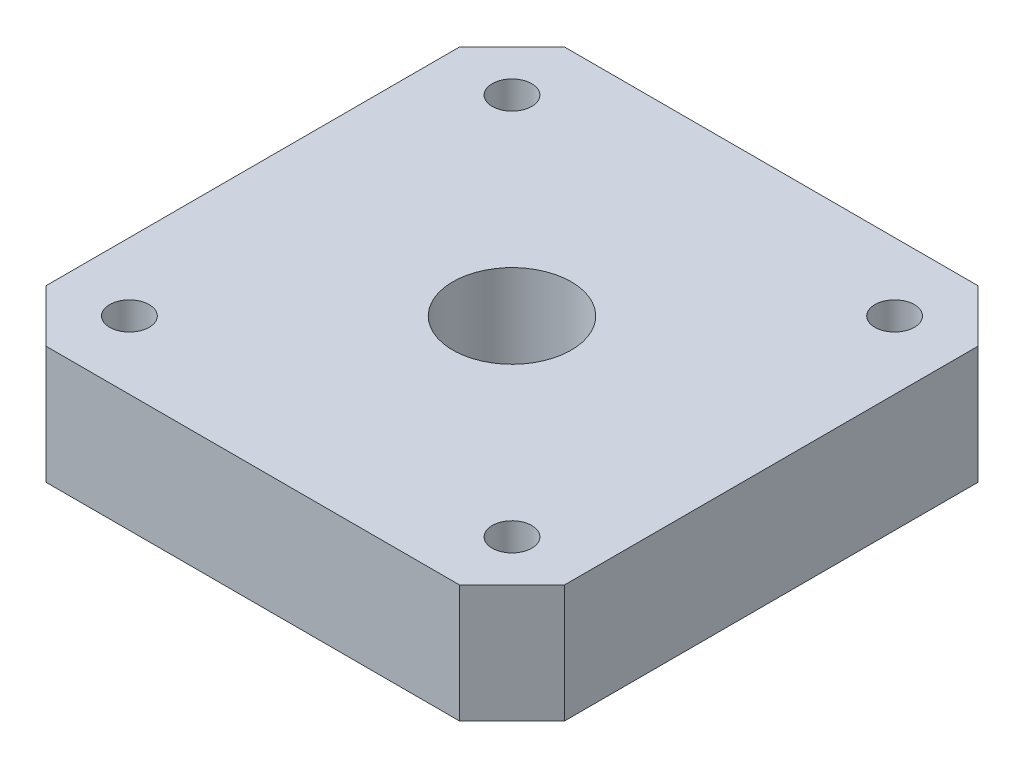
from build123d import *

# Parameters (mm, degrees)
ESBO_O1_W             = 42
ESBO_O1_H             = 42
FLANGE_BASE1_DEPTH    = 9.55
CORTE_EXTRUS_O2_DEPTH = 32.196193678
ESBO_O4_R             = 4.8
CORTE_EXTRUS_O4_DEPTH = 32.196193678
ESBO_O16_R            = 2
CORTE_EXTRUS_O6_DEPTH = 3
ESBO_O19_R            = 1.6
CORTE_EXTRUS_O7_DEPTH = 31.412209719


# Sheet-metal steps are written as plain solids
with BuildPart() as part:
    # Esboço1 → Flange-base1 (new body)
    with BuildSketch(Plane(origin=(0, 0, 0), x_dir=(1, 0, 0), z_dir=(0, 1, 0))):
        Rectangle(ESBO_O1_W, ESBO_O1_H)
    extrude(amount=-FLANGE_BASE1_DEPTH)

    # Esboço3 → Corte-extrusão2 (cut, through all)
    with BuildSketch(Plane.XZ.offset(9.55)):
        Polygon((-21, 16.757359313), (-16.757359313, 21), (-21, 21), align=None)
        Polygon((-21, -21), (-21, -16.757359313), (-16.757359313, -21), align=None)
        Polygon((21, -21), (21, -16.757359313), (16.757359313, -21), align=None)
        Polygon((21, 16.757359313), (21, 21), (16.757359313, 21), align=None)
    extrude(amount=-CORTE_EXTRUS_O2_DEPTH, mode=Mode.SUBTRACT)

    # Esboço4 → Corte-extrusão4 (cut, through all)
    with BuildSketch(Plane.XZ.offset(9.55)):
        with Locations(Location((0, 0, 0), (0, 0, 270))):
            Circle(ESBO_O4_R)
    extrude(amount=-CORTE_EXTRUS_O4_DEPTH, mode=Mode.SUBTRACT)

    # Esboço16 → Corte-extrusão6 (cut)
    with BuildSketch(Plane.XZ.offset(9.55)):
        with Locations(Location((-15.5, -15.5, 0), (0, 0, 270))):
            Circle(ESBO_O16_R)
        with Locations(Location((-15.5, 15.5, 0), (0, 0, 270))):
            Circle(ESBO_O16_R)
        with Locations(Location((15.5, 15.5, 0), (0, 0, 270))):
            Circle(ESBO_O16_R)
        with Locations(Location((15.5, -15.5, 0), (0, 0, 270))):
            Circle(ESBO_O16_R)
    extrude(amount=-CORTE_EXTRUS_O6_DEPTH, mode=Mode.SUBTRACT)

    # Esboço19 → Corte-extrusão7 (cut, through all)
    with BuildSketch(Plane.XZ.offset(6.55)):
        with Locations(Location((15.5, -15.5, 0), (0, 0, 270))):
            Circle(ESBO_O19_R)
        with Locations(Location((-15.5, -15.5, 0), (0, 0, 270))):
            Circle(ESBO_O19_R)
        with Locations(Location((15.5, 15.5, 0), (0, 0, 270))):
            Circle(ESBO_O19_R)
        with Locations(Location((-15.5, 15.5, 0), (0, 0, 270))):
            Circle(ESBO_O19_R)
    extrude(amount=-CORTE_EXTRUS_O7_DEPTH, mode=Mode.SUBTRACT)


solid = part.part
